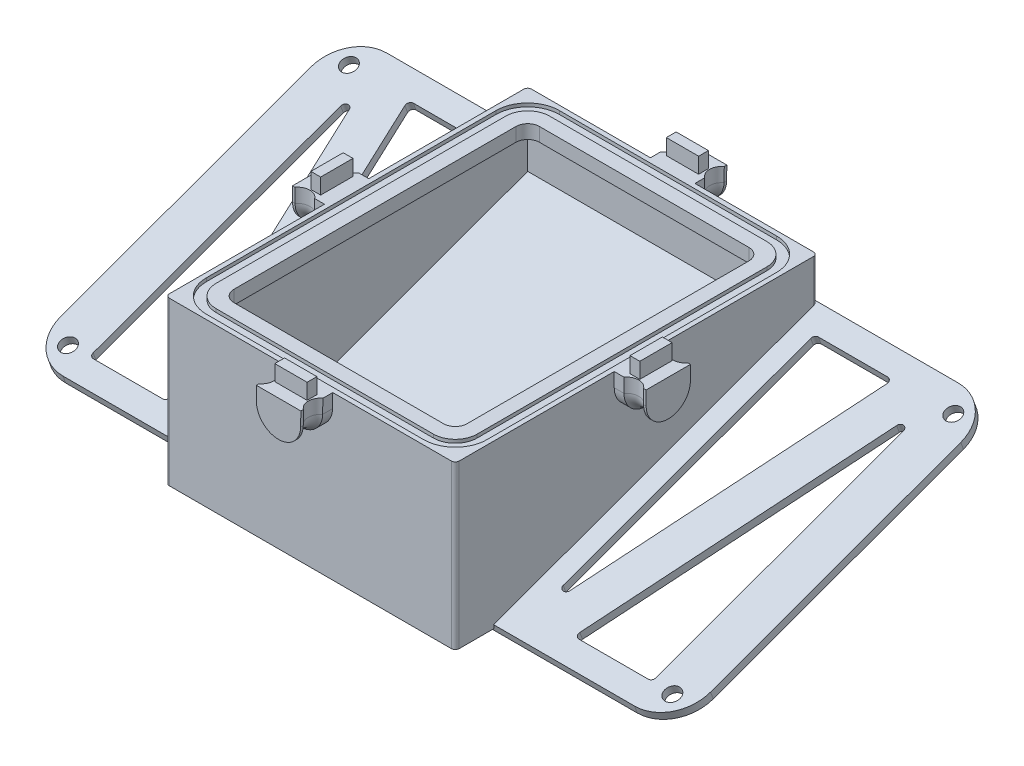
from build123d import *

# Parameters (mm, degrees)
SKETCH1_W            = 93.98
SKETCH1_H            = 117.461538
BOSS_EXTRUDE1_DEPTH  = 4.445
BOSS_EXTRUDE2_DEPTH  = 10.3505
CUT_EXTRUDE3_DEPTH   = 4.572
CUT_REVOLVE2_ANGLE   = 180
BOSS_EXTRUDE3_DEPTH  = 5.08
BOSS_EXTRUDE4_DEPTH  = 10.3505
CUT_EXTRUDE4_START   = -4.572
CUT_EXTRUDE4_DEPTH   = 14.572
CUT_REVOLVE3_ANGLE   = 180
SKETCH23_W           = 10.4775
SKETCH23_H           = 3.175
BOSS_EXTRUDE5_DEPTH  = 5.08
FILLET4_R            = 1.27
CUT_EXTRUDE5_DEPTH   = 1.11125
BOSS_EXTRUDE11_DEPTH = 8.89
SKETCH30_W           = 59.69
SKETCH30_H           = 111.76
SKETCH30_W_2         = 91.44
BOSS_EXTRUDE12_DEPTH = 2.54
BOSS_EXTRUDE19_REACH = 154.194
BOSS_EXTRUDE20_REACH = 156.804
SKETCH36_W           = 7.621111653
SKETCH36_H           = 7.62
SKETCH36_W_2         = 7.62
SKETCH37_R           = 2.4765
CUT_EXTRUDE6_DEPTH   = 25.4
FILLET7_R            = 12.7
CUT_EXTRUDE7_DEPTH   = 10.16
FILLET8_R            = 1.27
BOSS_EXTRUDE21_REACH = 156.804
BOSS_EXTRUDE22_DEPTH = 48.26
SKETCH43_W           = 78.738888347
SKETCH43_H           = 3.803959625
BOSS_EXTRUDE23_DEPTH = 7.62
SKETCH44_W           = 75.565
SKETCH44_H           = 99.046538
CUT_EXTRUDE8_DEPTH   = 7.62
FILLET9_R            = 3.81
FILLET10_R           = 1.27


with BuildPart() as part:
    # Sketch1 → Boss-Extrude1 (new body)
    with BuildSketch(Plane(origin=(0, 0, 0), x_dir=(1, 0, 0), z_dir=(0, 1, 0))):
        with Locations((7.564508899, -24.46347216)):
            Rectangle(SKETCH1_W, SKETCH1_H)
    extrude(amount=BOSS_EXTRUDE1_DEPTH)

    # Sketch7 → Boss-Extrude2 (add)
    with BuildSketch(Plane.ZY.offset(39.425491101)):
        with BuildLine():
            Line((31.63897216, -0.127), (31.63897216, 4.445))
            Line((31.63897216, 4.445), (17.28797216, 4.445))
            Line((17.28797216, 4.445), (17.28797216, -0.127))
            ThreePointArc((17.28797216, -0.127), (24.46347216, -7.3025), (31.63897216, -0.127))
        make_face()
    boss_extrude2 = extrude(amount=BOSS_EXTRUDE2_DEPTH)

    # Sketch8 → Cut-Extrude3 (cut)
    with BuildSketch(Plane(origin=(0, 4.445, 0), x_dir=(1, 0, 0), z_dir=(0, 1, 0))):
        with BuildLine():
            Line((-45.775491101, -31.63897216), (-42.600491101, -31.63897216))
            ThreePointArc((-42.600491101, -31.63897216), (-45.775491101, -30.05147216), (-48.950491101, -31.63897216))
            Line((-48.950491101, -31.63897216), (-45.775491101, -31.63897216))
        make_face()
        with BuildLine():
            ThreePointArc((-48.950491101, -17.28797216), (-45.775491101, -18.87547216), (-42.600491101, -17.28797216))
            Line((-42.600491101, -17.28797216), (-45.775491101, -17.28797216))
            Line((-45.775491101, -17.28797216), (-48.950491101, -17.28797216))
        make_face()
    cut_extrude3 = extrude(amount=-CUT_EXTRUDE3_DEPTH, mode=Mode.SUBTRACT)

    # Sketch9 → Cut-Revolve2 (revolve, cut)
    with BuildSketch(Plane(origin=(0, -0.127, 0), x_dir=(1, 0, 0), z_dir=(0, 1, 0))):
        with BuildLine():
            Line((-42.600491101, -31.63897216), (-48.950491101, -31.63897216))
            ThreePointArc((-48.950491101, -31.63897216), (-45.775491101, -30.05147216), (-42.600491101, -31.63897216))
        make_face()
    cut_revolve2 = revolve(axis=Axis((-45.775491101, -0.127, 24.46347216), (1, 0, 0)), revolution_arc=CUT_REVOLVE2_ANGLE, mode=Mode.SUBTRACT)

    # Sketch17 → Boss-Extrude3 (add)
    with BuildSketch(Plane(origin=(0, 4.445, 0), x_dir=(1, 0, 0), z_dir=(0, 1, 0))):
        Polygon((-42.600491101, -24.46347216), (-42.600491101, -29.70222216), (-45.775491101, -29.70222216), (-45.775491101, -24.46347216), (-45.775491101, -19.22472216), (-42.600491101, -19.22472216), align=None)
    boss_extrude3 = extrude(amount=BOSS_EXTRUDE3_DEPTH)

    # Mirror1: Boss-Extrude2, Cut-Extrude3, Cut-Revolve2, Boss-Extrude3 across plane
    add(boss_extrude2.mirror(Plane.ZY.offset(-7.564508899)))
    add(cut_extrude3.mirror(Plane.ZY.offset(-7.564508899)), mode=Mode.SUBTRACT)
    add(cut_revolve2.mirror(Plane.ZY.offset(-7.564508899)), mode=Mode.SUBTRACT)
    add(boss_extrude3.mirror(Plane.ZY.offset(-7.564508899)))

    # Sketch18 → Boss-Extrude4 (add)
    with BuildSketch(Plane.XY.offset(83.19424116)):
        with BuildLine():
            Line((14.738897419, -0.1262918), (14.819366531, 4.445))
            Line((14.819366531, 4.445), (0.389008899, 4.445))
            Line((0.389008899, 4.445), (0.389008899, 0))
            ThreePointArc((0.389008899, 0), (7.501360554, -7.175222125), (14.738897419, -0.1262918))
        make_face()
    boss_extrude4 = extrude(amount=BOSS_EXTRUDE4_DEPTH)

    # Sketch19 → Cut-Extrude4 (cut)
    with BuildSketch(Plane(origin=(0, 4.445, 0), x_dir=(1, 0, 0), z_dir=(0, 1, 0)).offset(CUT_EXTRUDE4_START)):
        with BuildLine():
            Line((0.389008899, -89.54424116), (0.389008899, -92.71924116))
            ThreePointArc((0.389008899, -92.71924116), (1.976508899, -89.54424116), (0.389008899, -86.36924116))
            Line((0.389008899, -86.36924116), (0.389008899, -89.54424116))
        make_face()
        with BuildLine():
            Line((14.819366531, -89.54424116), (14.819366531, -86.36924116))
            ThreePointArc((14.819366531, -86.36924116), (13.231866531, -89.54424116), (14.819366531, -92.71924116))
            Line((14.819366531, -92.71924116), (14.819366531, -89.54424116))
        make_face()
    cut_extrude4 = extrude(amount=CUT_EXTRUDE4_DEPTH, mode=Mode.SUBTRACT)

    # Sketch20 → Cut-Revolve3 (revolve, cut)
    with BuildSketch(Plane(origin=(0, -0.127, 0), x_dir=(1, 0, 0), z_dir=(0, 1, 0))):
        with BuildLine():
            Line((0.389008899, -92.71924116), (0.389008899, -86.36924116))
            ThreePointArc((0.389008899, -86.36924116), (1.976508899, -89.54424116), (0.389008899, -92.71924116))
        make_face()
    cut_revolve3 = revolve(axis=Axis((7.564508899, -0.127, 89.54424116), (0, 0, 1)), revolution_arc=CUT_REVOLVE3_ANGLE, mode=Mode.SUBTRACT)

    # Sketch23 → Boss-Extrude5 (add)
    with BuildSketch(Plane(origin=(0, 4.445, 0), x_dir=(1, 0, 0), z_dir=(0, 1, 0))):
        with Locations((7.604187715, -87.95674116)):
            Rectangle(SKETCH23_W, SKETCH23_H)
    boss_extrude5 = extrude(amount=BOSS_EXTRUDE5_DEPTH)

    # Fillet4
    fillet4_edges = [part.edges().sort_by_distance(p)[0] for p in [
        (-39.425491101, 2.2225, -34.26729684),
        (54.554508899, 2.2225, -34.26729684),
    ]]
    fillet(fillet4_edges, radius=FILLET4_R)

    # Mirror2: Boss-Extrude4, Cut-Extrude4, Cut-Revolve3, Boss-Extrude5 across plane
    add(boss_extrude4.mirror(Plane.XY.offset(24.46347216)))
    add(cut_extrude4.mirror(Plane.XY.offset(24.46347216)), mode=Mode.SUBTRACT)
    add(cut_revolve3.mirror(Plane.XY.offset(24.46347216)), mode=Mode.SUBTRACT)
    add(boss_extrude5.mirror(Plane.XY.offset(24.46347216)))

    # Sketch24 → Cut-Extrude5 (cut)
    with BuildSketch(Plane(origin=(0, 4.445, 0), x_dir=(1, 0, 0), z_dir=(0, 1, 0))):
        with BuildLine():
            Line((14.819366531, 32.75917184), (0.389008899, 32.75917184))
            Line((0.389008899, 32.75917184), (-27.677991101, 32.75917184))
            ThreePointArc((-27.677991101, 32.75917184), (-34.918322598, 29.760128337), (-37.917366101, 22.51979684))
            Line((-37.917366101, 22.51979684), (-37.917366101, -17.28797216))
            Line((-37.917366101, -17.28797216), (-37.917366101, -31.63897216))
            Line((-37.917366101, -31.63897216), (-37.917366101, -71.44674116))
            ThreePointArc((-37.917366101, -71.44674116), (-34.918322598, -78.687072658), (-27.677991101, -81.68611616))
            Line((-27.677991101, -81.68611616), (0.389008899, -81.68611616))
            Line((0.389008899, -81.68611616), (14.819366531, -81.68611616))
            Line((14.819366531, -81.68611616), (42.807008899, -81.68611616))
            ThreePointArc((42.807008899, -81.68611616), (50.047340397, -78.687072658), (53.046383899, -71.44674116))
            Line((53.046383899, -71.44674116), (53.046383899, -31.63897216))
            Line((53.046383899, -31.63897216), (53.046383899, -17.28797216))
            Line((53.046383899, -17.28797216), (53.046383899, 22.51979684))
            ThreePointArc((53.046383899, 22.51979684), (50.047340397, 29.760128337), (42.807008899, 32.75917184))
            Line((42.807008899, 32.75917184), (14.819366531, 32.75917184))
        make_face()
        with BuildLine():
            Line((42.807008899, 29.61592184), (14.819366531, 29.61592184))
            Line((14.819366531, 29.61592184), (0.389008899, 29.61592184))
            Line((0.389008899, 29.61592184), (-27.677991101, 29.61592184))
            ThreePointArc((-27.677991101, 29.61592184), (-32.695709208, 27.537514947), (-34.774116101, 22.51979684))
            Line((-34.774116101, 22.51979684), (-34.774116101, -17.28797216))
            Line((-34.774116101, -17.28797216), (-34.774116101, -31.63897216))
            Line((-34.774116101, -31.63897216), (-34.774116101, -71.44674116))
            ThreePointArc((-34.774116101, -71.44674116), (-32.695709208, -76.464459268), (-27.677991101, -78.54286616))
            Line((-27.677991101, -78.54286616), (0.389008899, -78.54286616))
            Line((0.389008899, -78.54286616), (14.819366531, -78.54286616))
            Line((14.819366531, -78.54286616), (42.807008899, -78.54286616))
            ThreePointArc((42.807008899, -78.54286616), (47.824727007, -76.464459268), (49.903133899, -71.44674116))
            Line((49.903133899, -71.44674116), (49.903133899, -31.63897216))
            Line((49.903133899, -31.63897216), (49.903133899, -17.28797216))
            Line((49.903133899, -17.28797216), (49.903133899, 22.51979684))
            ThreePointArc((49.903133899, 22.51979684), (47.824727007, 27.537514947), (42.807008899, 29.61592184))
        make_face(mode=Mode.SUBTRACT)
    extrude(amount=-CUT_EXTRUDE5_DEPTH, mode=Mode.SUBTRACT)

    # Sketch28 → Boss-Extrude11 (add)
    with BuildSketch(Plane.XZ):
        with BuildLine():
            Line((46.934508899, -34.26729684), (53.284508899, -34.26729684))
            ThreePointArc((53.284508899, -34.26729684), (54.182534511, -33.895322452), (54.554508899, -32.99729684))
            Line((54.554508899, -32.99729684), (54.554508899, -26.64729684))
            Line((54.554508899, -26.64729684), (46.934508899, -26.64729684))
            Line((46.934508899, -26.64729684), (46.934508899, -34.26729684))
        make_face()
        with BuildLine():
            Line((-38.154379448, -34.26729684), (-31.804379448, -34.26729684))
            Line((-31.804379448, -34.26729684), (-31.804379448, -26.64729684))
            Line((-31.804379448, -26.64729684), (-39.424379448, -26.64729684))
            Line((-39.424379448, -26.64729684), (-39.424379448, -32.99729684))
            ThreePointArc((-39.424379448, -32.99729684), (-39.052798003, -33.894929337), (-38.1554911, -34.267296353))
            ThreePointArc((-38.1554911, -34.267296353), (-38.154935274, -34.267296718), (-38.154379448, -34.26729684))
        make_face()
    extrude(amount=BOSS_EXTRUDE11_DEPTH)



with BuildPart() as body_2:
    # Sketch30 → Boss-Extrude12 (new body)
    with BuildSketch(Plane(origin=(0, -18.863364463, -6.865703183), x_dir=(1, 0, 0), z_dir=(0, -0.9396926207859081, -0.34202014332566943))):
        with Locations((-68.000491101, 26.7198331)):
            Rectangle(SKETCH30_W, SKETCH30_H)
        with Locations((7.564508899, 26.7198331)):
            Rectangle(SKETCH30_W_2, SKETCH30_H)
        with Locations((83.129508899, 26.7198331)):
            Rectangle(SKETCH30_W, SKETCH30_H)
    extrude(amount=BOSS_EXTRUDE12_DEPTH)


with BuildPart() as part_1:
    add(part.part)

    # Boss-Extrude19: up to this face of the body (flat: up to its plane)
    boss_extrude19_end = Plane(body_2.part.faces().sort_by_distance((7.564508899, -28.002085609, 18.24272681))[0])
    # Sketch34 → Boss-Extrude19 (add, up to the picked face)
    with BuildSketch(Plane.XZ.offset(8.89), mode=Mode.PRIVATE) as boss_extrude19_sk1:
        with BuildLine():
            Line((-31.804379448, -26.64729684), (-39.424379448, -26.64729684))
            Line((-39.424379448, -26.64729684), (-39.424379448, -32.99729684))
            ThreePointArc((-39.424379448, -32.99729684), (-39.052798347, -33.894929681), (-38.155491101, -34.26729684))
            Line((-38.155491101, -34.26729684), (-31.804379448, -34.26729684))
            Line((-31.804379448, -34.26729684), (-31.804379448, -26.64729684))
        make_face()
    boss_extrude19_tool1 = split(extrude(boss_extrude19_sk1.sketch, amount=BOSS_EXTRUDE19_REACH, mode=Mode.PRIVATE), bisect_by=boss_extrude19_end, keep=Keep.BOTH, mode=Mode.PRIVATE)
    # Sketch34 → Boss-Extrude19 (add, up to the picked face)
    with BuildSketch(Plane.XZ.offset(8.89), mode=Mode.PRIVATE) as boss_extrude19_sk2:
        with BuildLine():
            Line((46.934508899, -26.64729684), (46.934508899, -34.26729684))
            Line((46.934508899, -34.26729684), (53.284508899, -34.26729684))
            ThreePointArc((53.284508899, -34.26729684), (54.182534511, -33.895322452), (54.554508899, -32.99729684))
            Line((54.554508899, -32.99729684), (54.554508899, -26.64729684))
            Line((54.554508899, -26.64729684), (46.934508899, -26.64729684))
        make_face()
    boss_extrude19_tool2 = split(extrude(boss_extrude19_sk2.sketch, amount=BOSS_EXTRUDE19_REACH, mode=Mode.PRIVATE), bisect_by=boss_extrude19_end, keep=Keep.BOTH, mode=Mode.PRIVATE)
    add(boss_extrude19_tool1.solids().sort_by(Axis((-35.593232, -8.89, -30.43615), (0, -1, 0)))[0])
    add(boss_extrude19_tool2.solids().sort_by(Axis((50.723362, -8.89, -30.43615), (0, -1, 0)))[0])


    add(body_2.part)  # Boss-Extrude20 merges body 2
    # Boss-Extrude20: up to this plane
    boss_extrude20_end = Plane(origin=(0, -18.863364463, -6.865703183), z_dir=(0, -0.9396926207859081, -0.34202014332566943))
    # Sketch36 → Boss-Extrude20 (add, up to the surface)
    with BuildSketch(Plane.XZ, mode=Mode.PRIVATE) as boss_extrude20_sk1:
        with Locations((-35.614935275, 66.82470316)):
            Rectangle(SKETCH36_W, SKETCH36_H)
    boss_extrude20_tool1 = split(extrude(boss_extrude20_sk1.sketch, amount=BOSS_EXTRUDE20_REACH, mode=Mode.PRIVATE), bisect_by=boss_extrude20_end, keep=Keep.BOTH, mode=Mode.PRIVATE)
    add(boss_extrude20_tool1.solids().sort_by_distance((-35.614935, 0, 66.824703))[0])
    # Sketch36 → Boss-Extrude20 (add, up to the surface)
    with BuildSketch(Plane.XZ, mode=Mode.PRIVATE) as boss_extrude20_sk2:
        with Locations((50.744508899, 66.82470316)):
            Rectangle(SKETCH36_W_2, SKETCH36_H)
    boss_extrude20_tool2 = split(extrude(boss_extrude20_sk2.sketch, amount=BOSS_EXTRUDE20_REACH, mode=Mode.PRIVATE), bisect_by=boss_extrude20_end, keep=Keep.BOTH, mode=Mode.PRIVATE)
    add(boss_extrude20_tool2.solids().sort_by_distance((50.744509, 0, 66.824703))[0])

    # Sketch37 → Cut-Extrude6 (cut)
    with BuildSketch(Plane(origin=(0, -21.250183719, -7.734434347), x_dir=(1, 0, 0), z_dir=(0, -0.9396926207859082, -0.34202014332566943))):
        with Locations(Location((-90.445491101, 75.1998331, 0), (0, 0, 270))):
            Circle(SKETCH37_R)
        with Locations(Location((-90.445491101, -21.7601669, 0), (0, 0, 270))):
            Circle(SKETCH37_R)
        with Locations(Location((105.574508899, -21.7601669, 0), (0, 0, 270))):
            Circle(SKETCH37_R)
        with Locations(Location((105.574508899, 75.1998331, 0), (0, 0, 270))):
            Circle(SKETCH37_R)
    extrude(amount=-CUT_EXTRUDE6_DEPTH, mode=Mode.SUBTRACT)

    # Fillet7
    fillet7_edges = [part_1.edges().sort_by_distance(p)[0] for p in [
        (112.974508899, -48.307580846, 70.318384877),
        (112.974508899, -10.083409628, -34.701662422),
        (-97.845491101, -10.083409628, -34.701662422),
        (-97.845491101, -48.307580846, 70.318384877),
    ]]
    fillet(fillet7_edges, radius=FILLET7_R)

    # Sketch39 → Cut-Extrude7 (cut)
    with BuildSketch(Plane(origin=(0, -21.250183719, -7.734434347), x_dir=(-1, 0, 0), z_dir=(0, -0.9396926207859082, -0.34202014332566943))):
        Polygon((58.304453382, -74.9798331), (83.704453382, 21.5401669), (83.704453382, -74.9798331), align=None)
        Polygon((71.004453382, 21.5401669), (45.604453382, -74.9798331), (45.604453382, 21.5401669), align=None)
        Polygon((-60.733471181, 21.5401669), (-86.133471181, 21.5401669), (-60.733471181, -74.9798331), align=None)
        Polygon((-73.433471181, -74.9798331), (-98.833471181, 21.5401669), (-98.833471181, -74.9798331), align=None)
    extrude(amount=-CUT_EXTRUDE7_DEPTH, mode=Mode.SUBTRACT)

    # Fillet8
    fillet8_edges = [part_1.edges().sort_by_distance(p)[0] for p in [
        (-71.004453382, -12.689603121, -27.541204651),
        (-45.604453382, -45.701387354, 63.157927107),
        (-45.604453382, -12.689603121, -27.541204651),
        (86.133471181, -12.689603121, -27.541204651),
        (60.733471181, -12.689603121, -27.541204651),
        (60.733471181, -45.701387354, 63.157927107),
        (98.833471181, -12.689603121, -27.541204651),
        (73.433471181, -45.701387354, 63.157927107),
        (98.833471181, -45.701387354, 63.157927107),
        (-58.304453382, -45.701387354, 63.157927107),
        (-83.704453382, -12.689603121, -27.541204651),
        (-83.704453382, -45.701387354, 63.157927107),
    ]]
    fillet(fillet8_edges, radius=FILLET8_R)

    # Boss-Extrude21: up to this plane
    boss_extrude21_end = Plane(origin=(0, -18.863364463, -6.865703183), z_dir=(0, -0.9396926207859081, -0.34202014332566943))
    # Sketch41 → Boss-Extrude21 (add, up to the surface)
    with BuildSketch(Plane.XZ, mode=Mode.PRIVATE) as boss_extrude21_sk1:
        Polygon((46.934508899, 63.01470316), (46.934508899, -26.64729684), (54.554508899, -26.64729684), (54.554508899, 17.28797216), (54.554508899, 31.63897216), (54.554508899, 63.01470316), align=None)
    boss_extrude21_tool1 = split(extrude(boss_extrude21_sk1.sketch, amount=BOSS_EXTRUDE21_REACH, mode=Mode.PRIVATE), bisect_by=boss_extrude21_end, keep=Keep.BOTH, mode=Mode.PRIVATE)
    add(boss_extrude21_tool1.solids().sort_by_distance((50.744509, 0, 18.183703))[0])
    # Sketch41 → Boss-Extrude21 (add, up to the surface)
    with BuildSketch(Plane.XZ, mode=Mode.PRIVATE) as boss_extrude21_sk2:
        Polygon((46.934508899, -26.64729684), (-31.804379448, -26.64729684), (-31.804379448, -34.26729684), (0.389008899, -34.26729684), (14.741120552, -34.26729684), (46.934508899, -34.26729684), align=None)
    boss_extrude21_tool2 = split(extrude(boss_extrude21_sk2.sketch, amount=BOSS_EXTRUDE21_REACH, mode=Mode.PRIVATE), bisect_by=boss_extrude21_end, keep=Keep.BOTH, mode=Mode.PRIVATE)
    add(boss_extrude21_tool2.solids().sort_by_distance((7.565065, 0, -30.457297))[0])
    # Sketch41 → Boss-Extrude21 (add, up to the surface)
    with BuildSketch(Plane.XZ, mode=Mode.PRIVATE) as boss_extrude21_sk3:
        Polygon((-31.804379448, 63.01470316), (-31.804379448, -26.64729684), (-39.424379448, -26.64729684), (-39.425491101, 63.01470316), align=None)
    boss_extrude21_tool3 = split(extrude(boss_extrude21_sk3.sketch, amount=BOSS_EXTRUDE21_REACH, mode=Mode.PRIVATE), bisect_by=boss_extrude21_end, keep=Keep.BOTH, mode=Mode.PRIVATE)
    add(boss_extrude21_tool3.solids().sort_by_distance((-35.614657, 0, 18.184793))[0])

    # Sketch42 → Boss-Extrude22 (add)
    with BuildSketch(Plane.XZ):
        Polygon((46.934508899, 70.63470316), (54.554508899, 70.63470316), (54.554508899, 83.19424116), (46.934508899, 83.19424116), (46.934508899, 75.57424116), align=None)
        Polygon((46.934508899, 75.57424116), (46.934508899, 83.19424116), (14.741120552, 83.19424116), (0.389008899, 83.19424116), (-31.804379448, 83.19424116), (-31.804379448, 75.57424116), align=None)
        Polygon((-31.804379448, 70.63470316), (-31.804379448, 75.57424116), (-31.804379448, 83.19424116), (-39.425491101, 83.19424116), (-39.425491101, 70.63470316), align=None)
    extrude(amount=BOSS_EXTRUDE22_DEPTH)

    # Sketch43 → Boss-Extrude23 (add)
    with BuildSketch(Plane(origin=(0, 0, 75.57424116), x_dir=(-1, 0, 0), z_dir=(0, 0, -1))):
        with Locations((-7.565064725, -46.358020188)):
            Rectangle(SKETCH43_W, SKETCH43_H)
    extrude(amount=BOSS_EXTRUDE23_DEPTH)

    # Sketch44 → Cut-Extrude8 (cut)
    with BuildSketch(Plane(origin=(0, 4.445, 0), x_dir=(1, 0, 0), z_dir=(0, 1, 0))):
        with Locations((7.564508899, -24.46347216)):
            Rectangle(SKETCH44_W, SKETCH44_H)
    extrude(amount=-CUT_EXTRUDE8_DEPTH, mode=Mode.SUBTRACT)

    # Fillet9
    fillet9_edges = [part_1.edges().sort_by_distance(p)[0] for p in [
        (45.347008899, 2.2225, -25.05979684),
        (45.347008899, 2.2225, 73.98674116),
        (-30.217991101, 2.2225, 73.98674116),
        (-30.217991101, 2.2225, -25.05979684),
    ]]
    fillet(fillet9_edges, radius=FILLET9_R)

    # Fillet10
    fillet10_edges = [part_1.edges().sort_by_distance(p)[0] for p in [
        (-39.425491101, -21.9075, 83.19424116),
        (54.554508899, -21.9075, 83.19424116),
    ]]
    fillet(fillet10_edges, radius=FILLET10_R)


solid = part_1.part
